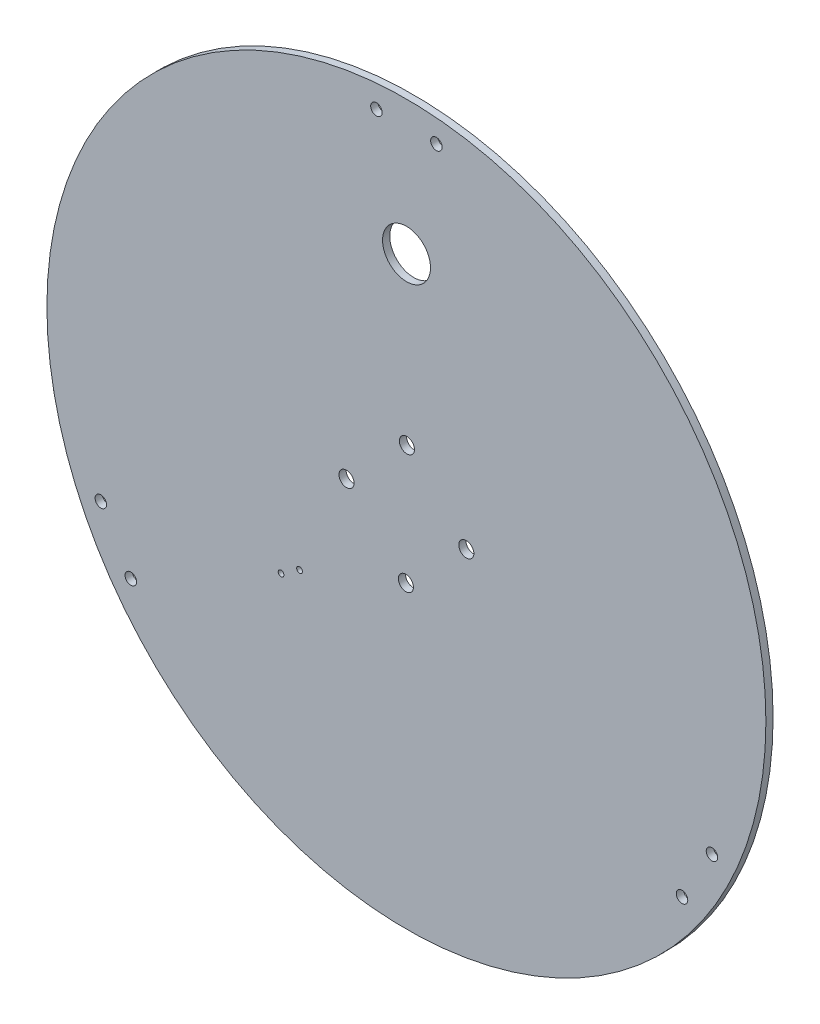
from build123d import *

# Parameters (mm, degrees)
SKETCH1_R           = 150
SKETCH1_R_2         = 2.4
SKETCH1_R_3         = 10
SKETCH1_R_4         = 1.2
SKETCH1_R_5         = 3.15
BOSS_EXTRUDE2_DEPTH = 3


with BuildPart() as part:
    # Sketch1 → Boss-Extrude2 (new body)
    with BuildSketch(Plane.XY):
        Circle(SKETCH1_R)
        with Locations((12.5, 140)):
            Circle(SKETCH1_R_2, mode=Mode.SUBTRACT)
        with Locations((-12.5, 140)):
            Circle(SKETCH1_R_2, mode=Mode.SUBTRACT)
        with Locations((127.49355653, -59.174682453)):
            Circle(SKETCH1_R_2, mode=Mode.SUBTRACT)
        with Locations((114.99355653, -80.825317547)):
            Circle(SKETCH1_R_2, mode=Mode.SUBTRACT)
        with Locations((-114.99355653, -80.825317547)):
            Circle(SKETCH1_R_2, mode=Mode.SUBTRACT)
        with Locations((-127.49355653, -59.174682453)):
            Circle(SKETCH1_R_2, mode=Mode.SUBTRACT)
        with Locations((0.048721242, 94)):
            Circle(SKETCH1_R_3, mode=Mode.SUBTRACT)
        with Locations((-44.588000359, -42.501161913)):
            Circle(SKETCH1_R_4, mode=Mode.SUBTRACT)
        with Locations((-52.288000359, -47.601161913)):
            Circle(SKETCH1_R_4, mode=Mode.SUBTRACT)
        with Locations((24.999072662, -0.21532771)):
            Circle(SKETCH1_R_5, mode=Mode.SUBTRACT)
        with Locations((-0.21532771, -24.999072662)):
            Circle(SKETCH1_R_5, mode=Mode.SUBTRACT)
        with Locations((-24.999072662, 0.21532771)):
            Circle(SKETCH1_R_5, mode=Mode.SUBTRACT)
        with Locations((0.21532771, 24.999072662)):
            Circle(SKETCH1_R_5, mode=Mode.SUBTRACT)
    extrude(amount=BOSS_EXTRUDE2_DEPTH)


solid = part.part
